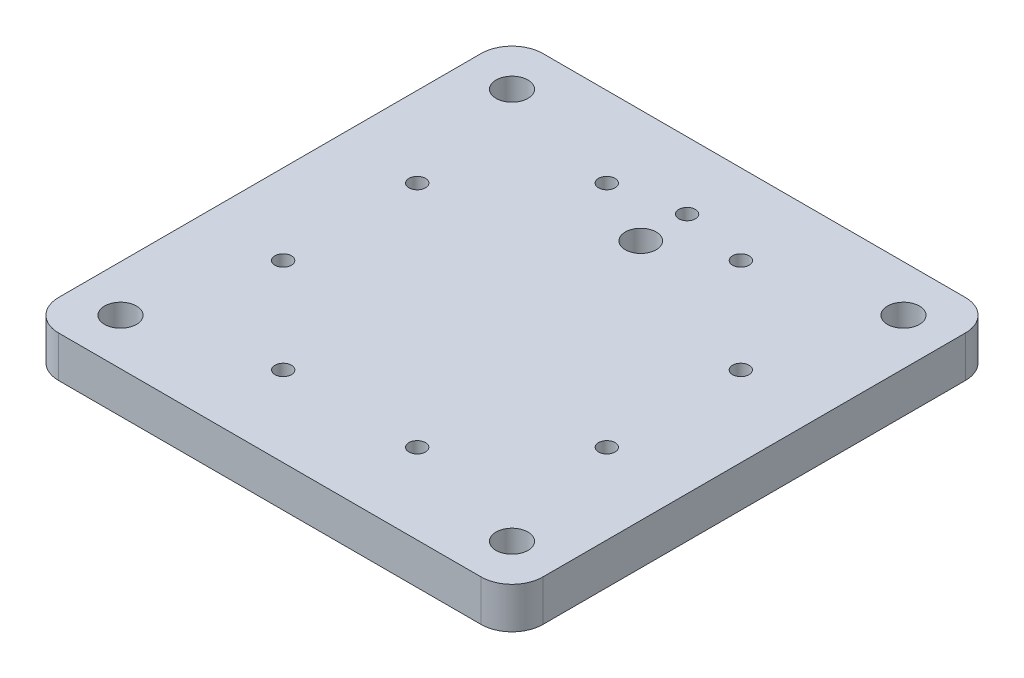
from build123d import *

# Parameters (mm, degrees)
SKETCH1_W           = 94
SKETCH1_H           = 94
SKETCH1_R           = 1.6
SKETCH1_R_2         = 3
SKETCH1_R_3         = 3.1
BOSS_EXTRUDE1_DEPTH = 8
FILLET1_R           = 6
SKETCH2_R           = 4.1
CUT_EXTRUDE1_DEPTH  = 3.5


with BuildPart() as part:
    # Sketch1 → Boss-Extrude1 (new body)
    with BuildSketch(Plane(origin=(0, 0, 0), x_dir=(1, 0, 0), z_dir=(0, 1, 0))):
        Rectangle(SKETCH1_W, SKETCH1_H)
        with Locations((-13.0112367, 31.411904105)):
            Circle(SKETCH1_R, mode=Mode.SUBTRACT)
        with Locations((13.0112367, 31.411904105)):
            Circle(SKETCH1_R, mode=Mode.SUBTRACT)
        with Locations((31.411904105, 13.0112367)):
            Circle(SKETCH1_R, mode=Mode.SUBTRACT)
        with Locations((31.411904105, -13.0112367)):
            Circle(SKETCH1_R, mode=Mode.SUBTRACT)
        with Locations((13.0112367, -31.411904105)):
            Circle(SKETCH1_R, mode=Mode.SUBTRACT)
        with Locations((-13.0112367, -31.411904105)):
            Circle(SKETCH1_R, mode=Mode.SUBTRACT)
        with Locations((-31.411904105, -13.0112367)):
            Circle(SKETCH1_R, mode=Mode.SUBTRACT)
        with Locations((-31.411904105, 13.0112367)):
            Circle(SKETCH1_R, mode=Mode.SUBTRACT)
        with Locations((0, 34)):
            Circle(SKETCH1_R, mode=Mode.SUBTRACT)
        with Locations((0, 25)):
            Circle(SKETCH1_R_2, mode=Mode.SUBTRACT)
        with Locations((-38, 38)):
            Circle(SKETCH1_R_3, mode=Mode.SUBTRACT)
        with Locations((38, 38)):
            Circle(SKETCH1_R_3, mode=Mode.SUBTRACT)
        with Locations((38, -38)):
            Circle(SKETCH1_R_3, mode=Mode.SUBTRACT)
        with Locations((-38, -38)):
            Circle(SKETCH1_R_3, mode=Mode.SUBTRACT)
    extrude(amount=BOSS_EXTRUDE1_DEPTH)

    # Fillet1
    fillet1_edges = [part.edges().sort_by_distance(p)[0] for p in [
        (-47, 4, 47),
        (-47, 4, -47),
        (47, 4, 47),
        (47, 4, -47),
    ]]
    fillet(fillet1_edges, radius=FILLET1_R)

    # Sketch2 → Cut-Extrude1 (cut)
    with BuildSketch(Plane.XZ):
        with Locations((-13.0112367, -31.411904105)):
            Circle(SKETCH2_R)
        with Locations((-31.411904105, -13.0112367)):
            Circle(SKETCH2_R)
        with Locations((-31.411904105, 13.0112367)):
            Circle(SKETCH2_R)
        with Locations((-13.0112367, 31.411904105)):
            Circle(SKETCH2_R)
        with Locations((13.0112367, 31.411904105)):
            Circle(SKETCH2_R)
        with Locations((31.411904105, 13.0112367)):
            Circle(SKETCH2_R)
        with Locations((31.411904105, -13.0112367)):
            Circle(SKETCH2_R)
        with Locations((13.0112367, -31.411904105)):
            Circle(SKETCH2_R)
    extrude(amount=-CUT_EXTRUDE1_DEPTH, mode=Mode.SUBTRACT)


solid = part.part
